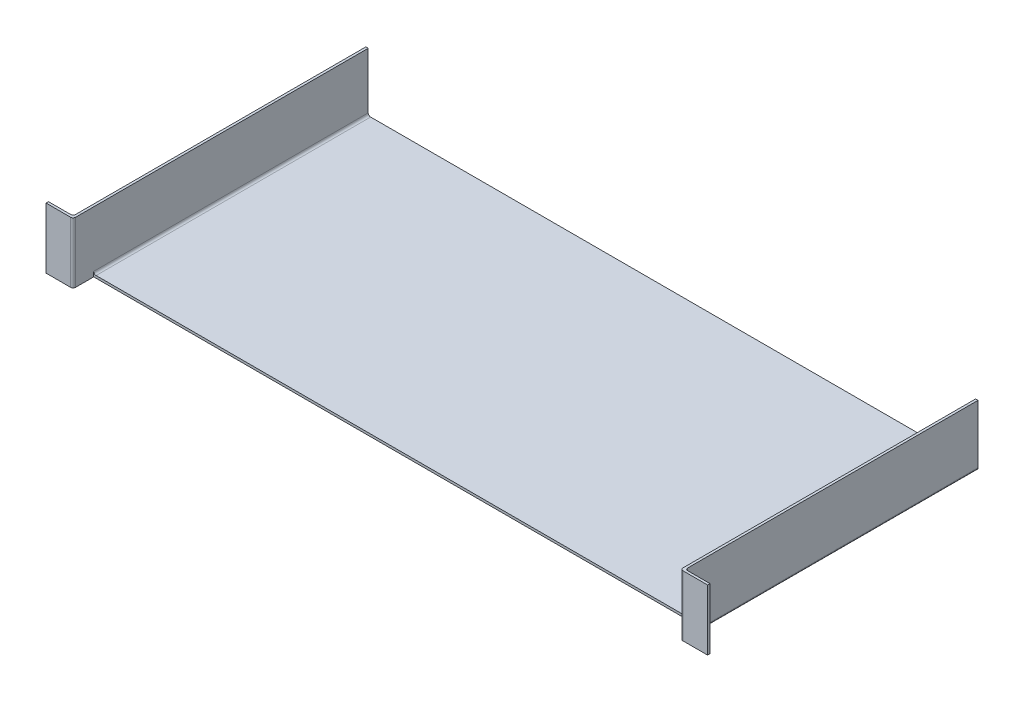
from build123d import *

# Parameters (mm, degrees)
BOSS_EXTRUDE1_DEPTH = 200
SKETCH2_W           = 1.75
SKETCH2_H           = 44.25
BOSS_EXTRUDE2_DEPTH = 15
SKETCH3_W           = 1.75
SKETCH3_H           = 44.25
BOSS_EXTRUDE3_DEPTH = 18
SKETCH4_W           = 1.75
SKETCH4_H           = 44.25
BOSS_EXTRUDE4_DEPTH = 18
FILLET1_R           = 1.75


with BuildPart() as part:
    # Sketch1 → Boss-Extrude1 (new body)
    with BuildSketch(Plane.XY):
        Polygon((-221.25, 0), (221.25, 0), (221.25, 42.5), (223, 42.5), (223, -1.75), (-223, -1.75), (-223, 42.5), (-221.25, 42.5), align=None)
    extrude(amount=BOSS_EXTRUDE1_DEPTH)

    # Sketch2 → Boss-Extrude2 (add)
    with BuildSketch(Plane.XY.offset(200)):
        with Locations((-222.125, 20.375)):
            Rectangle(SKETCH2_W, SKETCH2_H)
        with Locations((222.125, 20.375)):
            Rectangle(SKETCH2_W, SKETCH2_H)
    extrude(amount=BOSS_EXTRUDE2_DEPTH)

    # Sketch3 → Boss-Extrude3 (add)
    with BuildSketch(Plane(origin=(223, 0, 0), x_dir=(0, 0, -1), z_dir=(1, 0, 0))):
        with Locations((-214.125, 20.375)):
            Rectangle(SKETCH3_W, SKETCH3_H)
    extrude(amount=BOSS_EXTRUDE3_DEPTH)

    # Sketch4 → Boss-Extrude4 (add)
    with BuildSketch(Plane.ZY.offset(223)):
        with Locations((214.125, 20.375)):
            Rectangle(SKETCH4_W, SKETCH4_H)
    extrude(amount=BOSS_EXTRUDE4_DEPTH)

    # Fillet1
    # the kernel refuses this fillet: 1.75 mm, written as the material it adds along each edge
    with BuildSketch(Plane(origin=(-221.25, 0, 0), x_dir=(1, 0, 0), z_dir=(0, 0, 1))) as fillet1_piece_1:
        with BuildLine():
            CenterArc((FILLET1_R, FILLET1_R), FILLET1_R, 180, 90)
            Line((0, FILLET1_R), (0, 0))
            Line((0, 0), (FILLET1_R, 0))
        make_face()
    extrude(amount=200)
    with BuildSketch(Plane(origin=(221.25, 0, 0), x_dir=(-1, 0, 0), z_dir=(0, 0, 1))) as fillet1_piece_2:
        with BuildLine():
            CenterArc((FILLET1_R, -FILLET1_R), FILLET1_R, 90, 90)
            Line((0, -FILLET1_R), (0, 0))
            Line((0, 0), (FILLET1_R, 0))
        make_face()
    extrude(amount=200)
    with BuildSketch(Plane(origin=(223, -1.75, 213.25), x_dir=(1, 0, 0), z_dir=(0, 1, 0)), Plane(origin=(-223, -1.75, 213.25), x_dir=(0, 0, -1), z_dir=(0, 1, 0))) as fillet1_piece_3:
        with BuildLine():
            CenterArc((FILLET1_R, FILLET1_R), FILLET1_R, 180, 90)
            Line((0, FILLET1_R), (0, 0))
            Line((0, 0), (FILLET1_R, 0))
        make_face()
    extrude(amount=44.25)
    # the kernel refuses this fillet: 1.75 mm, written as the material it takes off along each edge
    with BuildSketch(Plane(origin=(-221.25, -6.125, 215), x_dir=(0, 0, -1), z_dir=(0, 1, 0))) as fillet1_2_piece_1:
        with BuildLine():
            CenterArc((FILLET1_R, FILLET1_R), FILLET1_R, 180, 90)
            Line((0, FILLET1_R), (0, 0))
            Line((0, 0), (FILLET1_R, 0))
        make_face()
    extrude(amount=53, mode=Mode.SUBTRACT)
    with BuildSketch(Plane(origin=(221.25, -6.125, 215), x_dir=(0, 0, -1), z_dir=(0, 1, 0))) as fillet1_2_piece_2:
        with BuildLine():
            CenterArc((FILLET1_R, -FILLET1_R), FILLET1_R, 90, 90)
            Line((0, -FILLET1_R), (0, 0))
            Line((0, 0), (FILLET1_R, 0))
        make_face()
    extrude(amount=53, mode=Mode.SUBTRACT)
    with BuildSketch(Plane(origin=(223, -1.75, 211.5), x_dir=(-1, 0, 0), z_dir=(0, 0, -1))) as fillet1_2_piece_3:
        with BuildLine():
            CenterArc((FILLET1_R, FILLET1_R), FILLET1_R, 180, 90)
            Line((0, FILLET1_R), (0, 0))
            Line((0, 0), (FILLET1_R, 0))
        make_face()
    extrude(amount=215.875, mode=Mode.SUBTRACT)
    with BuildSketch(Plane(origin=(-223, -1.75, 211.5), x_dir=(1, 0, 0), z_dir=(0, 0, -1))) as fillet1_2_piece_4:
        with BuildLine():
            CenterArc((FILLET1_R, -FILLET1_R), FILLET1_R, 90, 90)
            Line((0, -FILLET1_R), (0, 0))
            Line((0, 0), (FILLET1_R, 0))
        make_face()
    extrude(amount=215.875, mode=Mode.SUBTRACT)
    with BuildSketch(Plane(origin=(-224.75, -1.75, 211.5), x_dir=(1, 0, 0), z_dir=(0, 0, -1))) as fillet1_2_piece_5:
        with BuildLine():
            CenterArc((1.75 + FILLET1_R, -FILLET1_R), FILLET1_R, 90, 90)
            Line((1.75, -FILLET1_R), (1.75, 0))
            Line((1.75, 0), (1.75 + FILLET1_R, 0))
        make_face()
    revolve(axis=Axis((-224.75, -1.75, 211.5), (0, -1, 0)), revolution_arc=233.296989237, mode=Mode.SUBTRACT)
    with BuildSketch(Plane(origin=(224.75, -1.75, 211.5), x_dir=(0.5976672776328118, 0, -0.80174423929766), z_dir=(-0.80174423929766, 0, -0.5976672776328118))) as fillet1_2_piece_6:
        with BuildLine():
            CenterArc((1.75 + FILLET1_R, -FILLET1_R), FILLET1_R, 90, 90)
            Line((1.75, -FILLET1_R), (1.75, 0))
            Line((1.75, 0), (1.75 + FILLET1_R, 0))
        make_face()
    revolve(axis=Axis((224.75, -1.75, 211.5), (0, -1, 0)), revolution_arc=233.296989237, mode=Mode.SUBTRACT)


solid = part.part
